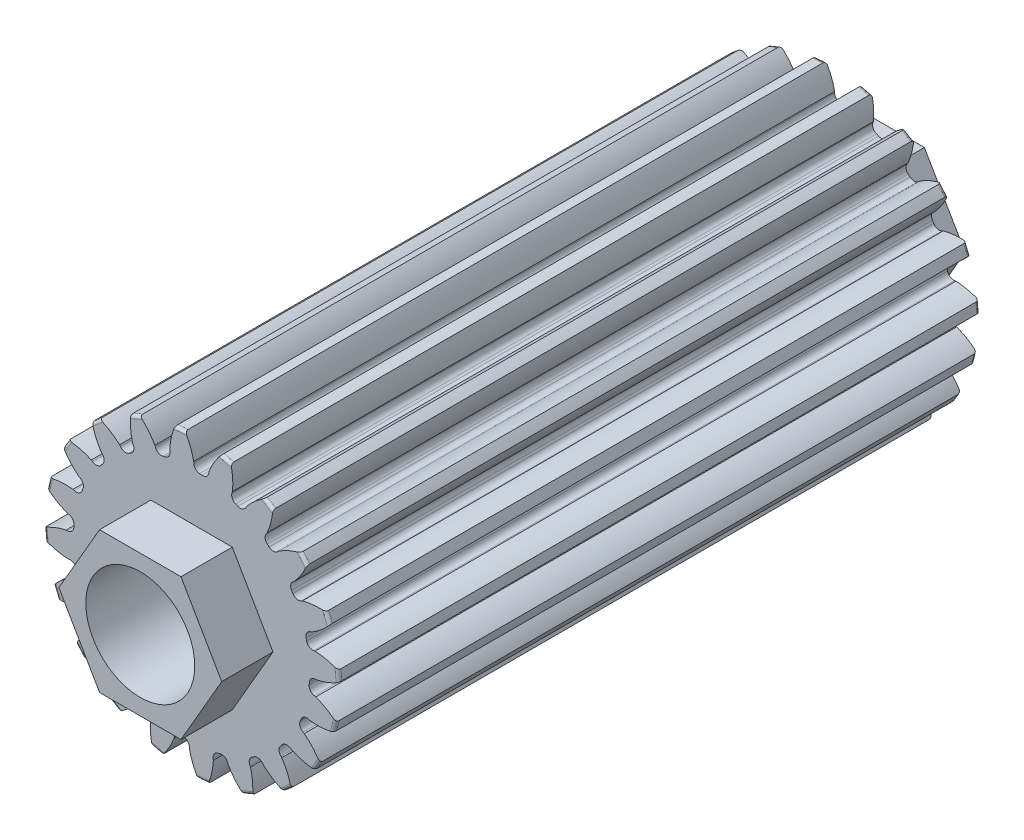
from build123d import *
from build123d.topology import SkipClean

# Parameters (mm, degrees)
SKETCH1_R                = 8.763
BOSS_EXTRUDE1_DEPTH      = 38.1
SKETCH2_W                = 6.3627
SKETCH2_H                = 5.953125
FILLET2_R                = 0.17526
CUT_EXTRUDE1_DEPTH       = 41.064826716
FILLET1_R                = 0.37404675
CIRPATTERN1_COUNT        = 20
FILLET1_OF_CIRPATTERN1_R = 0.37404675
SKETCH5_R                = 2.38125
CUT_EXTRUDE2_DEPTH       = 41.061065036
SKETCH8_R                = 3.2385
CUT_EXTRUDE4_DEPTH       = 41.061065036
SKETCH9_R                = 3.2385
BOSS_EXTRUDE2_DEPTH      = 3.048
BOSS_EXTRUDE3_START      = 3.048
SKETCH10_R               = 3.2385
BOSS_EXTRUDE3_DEPTH      = 3.048


with BuildPart() as part:
    # Sketch1 → Boss-Extrude1 (new body)
    with BuildSketch(Plane.XY):
        Circle(SKETCH1_R)
    extrude(amount=-BOSS_EXTRUDE1_DEPTH)

    # Sketch2 → Revolve1 (revolve)
    with BuildSketch(Plane(origin=(0, 0, 0), x_dir=(0, 0, -1), z_dir=(1, 0, 0))):
        with Locations((7.94385, 2.9765625)):
            Rectangle(SKETCH2_W, SKETCH2_H)
    revolve(axis=Axis((0, 0, -4.7625), (0, 0, -1)))

    # Fillet2
    fillet2_edges = [part.edges().sort_by_distance(p)[0] for p in [
        (-8.763, 0, -38.1),
        (-8.763, 0, 0),
    ]]
    fillet(fillet2_edges, radius=FILLET2_R)

    # Sketch4 → Cut-Extrude1 (cut, through all)
    with BuildSketch(Plane.XY):
        with BuildLine():
            Line((0.131764687, 7.457646233), (0.131764687, 7.017894383))
            ThreePointArc((0.131764687, 7.017894383), (0.550715976, 6.99749351), (0.967700662, 6.952104641))
            Line((0.967700662, 6.952104641), (1.036493167, 7.38644239))
            add(Edge.make_bspline(
                [(3.690312257, 9.886935858), (1.697229771, 9.111844986), (1.036493167, 7.38644239)],
                knots=[0, 0, 0, 1, 1, 1], degree=2))
            ThreePointArc((3.690312257, 9.886935858), (0.827995997, 10.520661949), (-2.098217069, 10.342504066))
            add(Edge.make_bspline(
                [(-2.098217069, 10.342504066), (-0.250924056, 9.265168378), (0.131764687, 7.457646233)],
                knots=[0, 0, 0, 1, 1, 1], degree=2))
        make_face()
    cut_extrude1 = extrude(amount=-CUT_EXTRUDE1_DEPTH, mode=Mode.SUBTRACT)

    # Fillet1
    fillet1_edges = [part.edges().sort_by_distance(p)[0] for p in [
        (0.967700662, 6.952104641, -19.05),
        (0.131764687, 7.017894383, -19.05),
    ]]
    fillet(fillet1_edges, radius=FILLET1_R)

    # CirPattern1: Cut-Extrude1 ×20 about axis
    cirpattern1_axis = Axis((0, 0, -38.1), (0, 0, 1))
    for i in range(1, CIRPATTERN1_COUNT):
        add(cut_extrude1.rotate(cirpattern1_axis, i * 360 / CIRPATTERN1_COUNT), mode=Mode.SUBTRACT)

    # Fillet1 of CirPattern1
    fillet1_of_cirpattern1_edges = [part.edges().sort_by_distance(p)[0] for p in [
        (-1.22798046, 6.91088037, -19.05),
        (-2.043332965, 6.715131711, -19.05),
        (-3.303458299, 6.193170979, -19.05),
        (-4.01841495, 5.75504516, -19.05),
        (-5.055570623, 4.869230861, -19.05),
        (-5.600146481, 4.231614691, -19.05),
        (-6.31280847, 3.068656501, -19.05),
        (-6.633696656, 2.293964293, -19.05),
        (-6.952104641, 0.967700662, -19.05),
        (-7.017894383, 0.131764687, -19.05),
        (-6.91088037, -1.22798046, -19.05),
        (-6.715131711, -2.043332965, -19.05),
        (-6.193170979, -3.303458299, -19.05),
        (-5.75504516, -4.01841495, -19.05),
        (-4.869230861, -5.055570623, -19.05),
        (-4.231614691, -5.600146481, -19.05),
        (-3.068656501, -6.31280847, -19.05),
        (-2.293964293, -6.633696656, -19.05),
        (-0.967700662, -6.952104641, -19.05),
        (-0.131764687, -7.017894383, -19.05),
        (1.22798046, -6.91088037, -19.05),
        (2.043332965, -6.715131711, -19.05),
        (3.303458299, -6.193170979, -19.05),
        (4.01841495, -5.75504516, -19.05),
        (5.055570623, -4.869230861, -19.05),
        (5.600146481, -4.231614691, -19.05),
        (6.31280847, -3.068656501, -19.05),
        (6.633696656, -2.293964293, -19.05),
        (6.952104641, -0.967700662, -19.05),
        (7.017894383, -0.131764687, -19.05),
        (6.91088037, 1.22798046, -19.05),
        (6.715131711, 2.043332965, -19.05),
        (6.193170979, 3.303458299, -19.05),
        (5.75504516, 4.01841495, -19.05),
        (4.869230861, 5.055570623, -19.05),
        (4.231614691, 5.600146481, -19.05),
        (3.068656501, 6.31280847, -19.05),
        (2.293964293, 6.633696656, -19.05),
    ]]
    fillet(fillet1_of_cirpattern1_edges, radius=FILLET1_OF_CIRPATTERN1_R)

    # Sketch5 → Cut-Extrude2 (cut, through all)
    with BuildSketch(Plane.XY):
        Circle(SKETCH5_R)
    extrude(amount=-CUT_EXTRUDE2_DEPTH, mode=Mode.SUBTRACT)

    # Sketch8 → Cut-Extrude4 (cut, through all)
    with BuildSketch(Plane.XY):
        Circle(SKETCH8_R)
    extrude(amount=-CUT_EXTRUDE4_DEPTH, mode=Mode.SUBTRACT)

    # Sketch9 → Boss-Extrude2 (add)
    with SkipClean():  # the faces are left unmerged after this step: merging them gives an invalid solid
        with BuildSketch(Plane(origin=(0, 0, -38.1), x_dir=(-1, 0, 0), z_dir=(0, 0, -1))):
            Polygon((2.419674978, 4.191), (-2.419674978, 4.191), (-4.839349956, 0), (-2.419674978, -4.191), (2.419674978, -4.191), (4.839349956, 0), align=None)
            Circle(SKETCH9_R, mode=Mode.SUBTRACT)
        extrude(amount=BOSS_EXTRUDE2_DEPTH)

    # Sketch10 → Boss-Extrude3 (add)
    with BuildSketch(Plane.XY.offset(BOSS_EXTRUDE3_START)):
        Polygon((2.419674978, 4.191), (-2.419674978, 4.191), (-4.839349956, 0), (-2.419674978, -4.191), (2.419674978, -4.191), (4.839349956, 0), align=None)
        Circle(SKETCH10_R, mode=Mode.SUBTRACT)
    extrude(amount=-BOSS_EXTRUDE3_DEPTH)


solid = part.part
